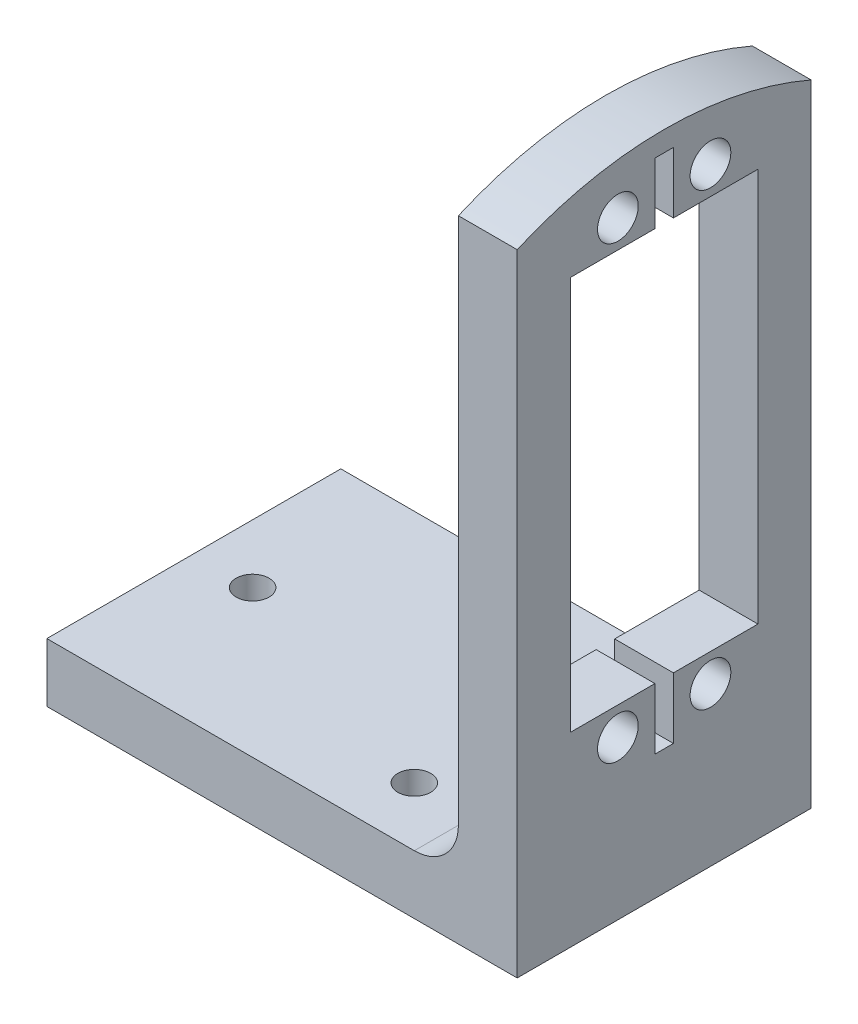
from build123d import *

# Parameters (mm, degrees)
SKETCH3_W           = 31.75
SKETCH3_H           = 68.999999922
SKETCH3_R           = 2.200000045
BOSS_EXTRUDE1_DEPTH = 6.35
SKETCH5_W           = 31.75
SKETCH5_H           = 6.35
BOSS_EXTRUDE2_DEPTH = 50.8
FILLET1_R           = 4.7625
SKETCH6_R           = 1.777000002
CUT_EXTRUDE1_DEPTH  = 89.004914574
CUT_EXTRUDE2_DEPTH  = 92.376706492


with BuildPart() as part:
    # Sketch3 → Boss-Extrude1 (new body)
    with BuildSketch(Plane(origin=(0, 0, 0), x_dir=(0, 0, -1), z_dir=(1, 0, 0))):
        with Locations((15.875, 34.499999961)):
            Rectangle(SKETCH3_W, SKETCH3_H)
        with Locations((10.874999967, 10.727499881)):
            Circle(SKETCH3_R, mode=Mode.SUBTRACT)
        with Locations((20.875000033, 10.727499881)):
            Circle(SKETCH3_R, mode=Mode.SUBTRACT)
        with Locations((10.874999967, 59.327499963)):
            Circle(SKETCH3_R, mode=Mode.SUBTRACT)
        with Locations((20.875000033, 59.327499963)):
            Circle(SKETCH3_R, mode=Mode.SUBTRACT)
        Polygon((5.748000061, 56.299999922), (14.875, 56.299999922), (14.875, 62.903999922), (16.875, 62.903999922), (16.875, 56.299999922), (26.001999939, 56.299999922), (26.001999939, 13.754999922), (16.875, 13.754999922), (16.875, 7.150999922), (14.875, 7.150999922), (14.875, 13.754999922), (5.748000061, 13.754999922), align=None, mode=Mode.SUBTRACT)
    extrude(amount=BOSS_EXTRUDE1_DEPTH)

    # Sketch5 → Boss-Extrude2 (add)
    with BuildSketch(Plane(origin=(6.35, 0, 0), x_dir=(0, 0, -1), z_dir=(1, 0, 0))):
        with Locations((15.875, -3.175)):
            Rectangle(SKETCH5_W, SKETCH5_H)
    extrude(amount=-BOSS_EXTRUDE2_DEPTH)

    # Fillet1
    fillet1_edges = [part.edges().sort_by_distance(p)[0] for p in [
        (0, 0, -15.875),
    ]]
    fillet(fillet1_edges, radius=FILLET1_R)

    # Sketch6 → Cut-Extrude1 (cut, through all)
    with BuildSketch(Plane(origin=(0, 0, 0), x_dir=(1, 0, 0), z_dir=(0, 1, 0))):
        with Locations((-11.1125, 6.35)):
            Circle(SKETCH6_R)
        with Locations((-38.1, 15.875)):
            Circle(SKETCH6_R)
        with Locations((-11.1125, 25.4)):
            Circle(SKETCH6_R)
    extrude(amount=-CUT_EXTRUDE1_DEPTH, mode=Mode.SUBTRACT)

    # Sketch7 → Cut-Extrude2 (cut, through all)
    with BuildSketch(Plane(origin=(6.35, 0, 0), x_dir=(0, 0, -1), z_dir=(1, 0, 0))):
        with BuildLine():
            Line((0, 61.774194579), (0, 68.999999922))
            Line((0, 68.999999922), (31.75, 68.999999922))
            Line((31.75, 68.999999922), (31.75, 61.774194579))
            ThreePointArc((31.75, 61.774194579), (15.875, 65.0875), (0, 61.774194579))
        make_face()
    extrude(amount=-CUT_EXTRUDE2_DEPTH, mode=Mode.SUBTRACT)


solid = part.part
